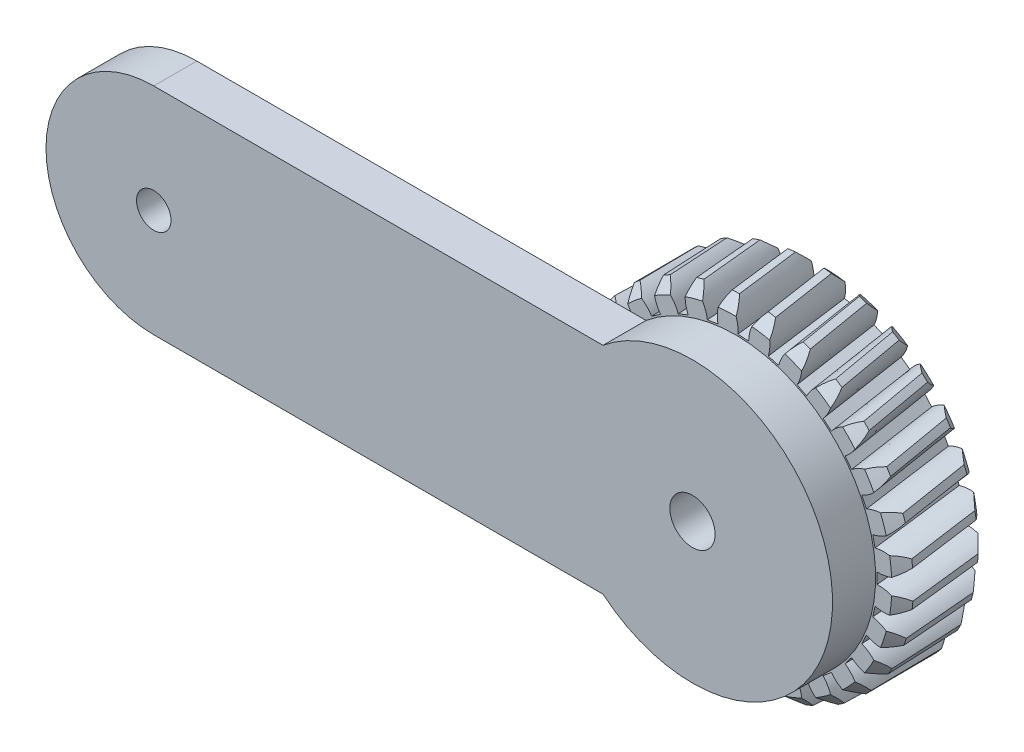
from build123d import *

# Parameters (mm, degrees)
SKETCH5_R           = 15.5
BOSS_EXTRUDE1_DEPTH = 8
CHAMFER1_SIZE       = 1
CUT_SWEEP1_PITCH    = 704.225352113
CUT_SWEEP1_HEIGHT   = 20
CUT_SWEEP1_RADIUS   = 15.5
CIRPATTERN1_COUNT   = 29
BOSS_EXTRUDE2_START = 8
SKETCH12_R          = 1.6
BOSS_EXTRUDE2_DEPTH = 4
SKETCH11_R          = 2.1
CUT_EXTRUDE1_DEPTH  = 15


with BuildPart() as part:
    # Sketch5 → Boss-Extrude1 (new body)
    with BuildSketch(Plane(origin=(0, 0, 0), x_dir=(0, 1, 0), z_dir=(0, 0, 1))):
        with Locations(Location((0, 0, 0), (0, 0, 270))):
            Circle(SKETCH5_R)
    extrude(amount=BOSS_EXTRUDE1_DEPTH)

    # Chamfer1
    chamfer1_edges = [part.edges().sort_by_distance(p)[0] for p in [
        (-15.5, 0, 0),
        (-15.5, 0, 8),
    ]]
    chamfer(chamfer1_edges, length=CHAMFER1_SIZE)

    # Cut-Sweep1: sweep along a helix
    with BuildLine() as cut_sweep1_path:
        Helix(CUT_SWEEP1_PITCH, CUT_SWEEP1_HEIGHT, CUT_SWEEP1_RADIUS, center=(0, 0, 8), direction=(0, 0, -1), lefthand=True)
    # Sketch10 → Cut-Sweep1 (sweep, cut)
    with BuildSketch(Plane.XY.offset(8)):
        with BuildLine():
            Line((13.143263094, 0.5), (13.143263094, -0.5))
            ThreePointArc((13.143263094, -0.5), (14.372434934, -0.691778507), (15.443263094, -1.325))
            ThreePointArc((15.443263094, -1.325), (15.5, 0), (15.443263094, 1.325))
            ThreePointArc((15.443263094, 1.325), (14.372434934, 0.691778507), (13.143263094, 0.5))
        make_face()
    cut_sweep1 = sweep(path=cut_sweep1_path.line, is_frenet=True, mode=Mode.SUBTRACT)

    # CirPattern1: Cut-Sweep1 ×29 about axis
    cirpattern1_axis = Axis((0, 0, 8), (0, 0, -1))
    for i in range(1, CIRPATTERN1_COUNT):
        add(cut_sweep1.rotate(cirpattern1_axis, i * 360 / CIRPATTERN1_COUNT), mode=Mode.SUBTRACT)

    # Sketch12 → Boss-Extrude2 (add)
    with BuildSketch(Plane(origin=(0, 0, 0), x_dir=(0, 1, 0), z_dir=(0, 0, 1)).offset(BOSS_EXTRUDE2_START)):
        with BuildLine():
            Line((10, 50), (10, 8.306623863))
            ThreePointArc((10, 8.306623863), (0, -13), (-10, 8.306623863))
            Line((-10, 8.306623863), (-10, 50))
            ThreePointArc((-10, 50), (0, 60), (10, 50))
        make_face()
        with Locations(Location((0, 50, 0), (0, 0, 270))):
            Circle(SKETCH12_R, mode=Mode.SUBTRACT)
    extrude(amount=BOSS_EXTRUDE2_DEPTH)

    # Sketch11 → Cut-Extrude1 (cut)
    with BuildSketch(Plane(origin=(0, 0, 0), x_dir=(0, 1, 0), z_dir=(0, 0, 1))):
        with Locations(Location((0, 0, 0), (0, 0, 270))):
            Circle(SKETCH11_R)
    extrude(amount=CUT_EXTRUDE1_DEPTH, mode=Mode.SUBTRACT)


solid = part.part
